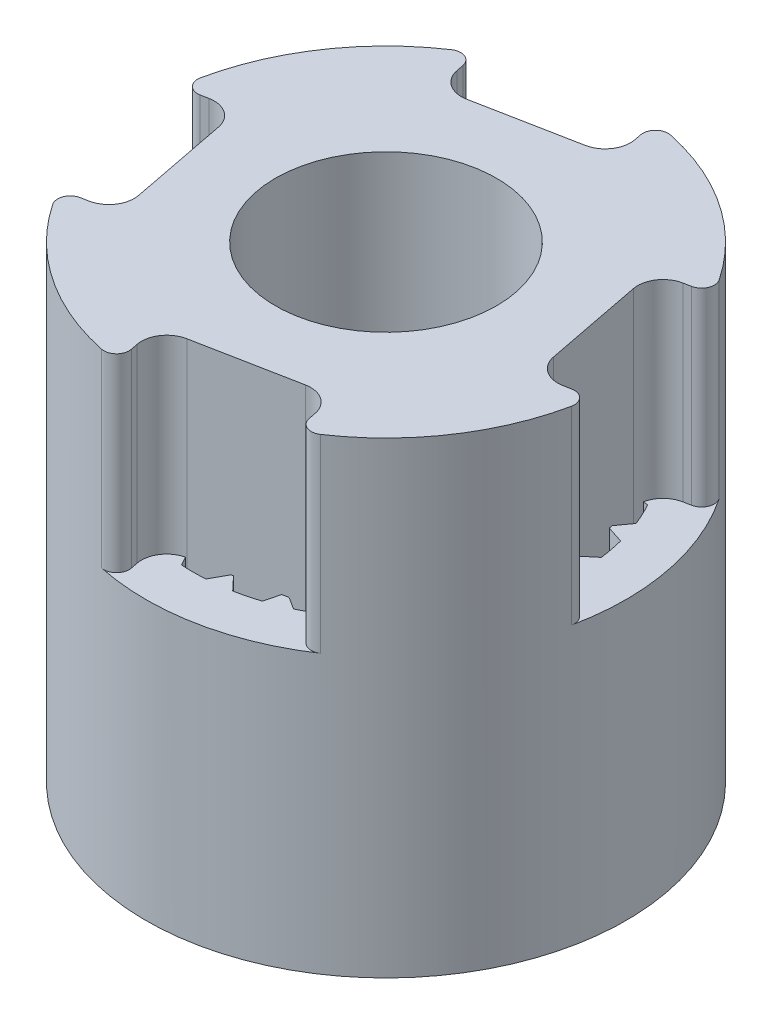
from build123d import *
from build123d.topology import SkipClean

# Parameters (mm, degrees)
BOSS_EXTRUDE1_DEPTH = 3
SKETCH3_R           = 3.8
BOSS_EXTRUDE2_DEPTH = 4.4
SKETCH4_R           = 1.75
CUT_EXTRUDE1_DEPTH  = 105.10898843
SKETCH5_R           = 1.75
BOSS_EXTRUDE3_DEPTH = 0.9


with BuildPart() as part:
    # Sketch1 → Boss-Extrude1 (new body)
    with BuildSketch(Plane(origin=(0, 107.625252291, 0), x_dir=(1, 0, 0), z_dir=(0, 1, 0))):
        with BuildLine():
            Line((-103.3593963, 2.700590533), (-103.244913379, 2.722839185))
            ThreePointArc((-103.244913379, 2.722839185), (-102.944914969, 2.661791791), (-102.775951086, 2.406493856))
            Line((-102.775951086, 2.406493856), (-102.470717158, 0.83587861))
            ThreePointArc((-102.470717158, 0.83587861), (-102.531764552, 0.5358802), (-102.787062488, 0.366916317))
            Line((-102.787062488, 0.366916317), (-102.901545409, 0.344667665))
            ThreePointArc((-102.901545409, 0.344667665), (-103.048087473, 0.225069339), (-103.029426375, 0.03684049))
            ThreePointArc((-103.029426375, 0.03684049), (-101.999811756, -0.994915362), (-100.657527711, -1.563158221))
            ThreePointArc((-100.657527711, -1.563158221), (-100.476010295, -1.509962698), (-100.42000237, -1.329293252))
            Line((-100.42000237, -1.329293252), (-100.442251022, -1.214810331))
            ThreePointArc((-100.442251022, -1.214810331), (-100.381203628, -0.914811922), (-100.125905692, -0.745848038))
            Line((-100.125905692, -0.745848038), (-98.555290447, -0.440614111))
            ThreePointArc((-98.555290447, -0.440614111), (-98.255292037, -0.501661505), (-98.086328154, -0.756959441))
            Line((-98.086328154, -0.756959441), (-98.064079502, -0.871442362))
            ThreePointArc((-98.064079502, -0.871442362), (-97.944481176, -1.017984426), (-97.756252327, -0.999323328))
            ThreePointArc((-97.756252327, -0.999323328), (-96.724496475, 0.030291291), (-96.156253616, 1.372575336))
            ThreePointArc((-96.156253616, 1.372575336), (-96.209449139, 1.554092752), (-96.390118585, 1.610100677))
            Line((-96.390118585, 1.610100677), (-96.504601506, 1.587852025))
            ThreePointArc((-96.504601506, 1.587852025), (-96.804599915, 1.648899419), (-96.973563799, 1.904197355))
            Line((-96.973563799, 1.904197355), (-97.278797726, 3.4748126))
            ThreePointArc((-97.278797726, 3.4748126), (-97.217750332, 3.77481101), (-96.962452396, 3.943774894))
            Line((-96.962452396, 3.943774894), (-96.847969475, 3.966023545))
            ThreePointArc((-96.847969475, 3.966023545), (-96.701427411, 4.085621871), (-96.720088509, 4.27385072))
            ThreePointArc((-96.720088509, 4.27385072), (-97.749703128, 5.305606573), (-99.091987173, 5.873849431))
            ThreePointArc((-99.091987173, 5.873849431), (-99.273504589, 5.820653908), (-99.329512514, 5.639984463))
            Line((-99.329512514, 5.639984463), (-99.307263862, 5.525501542))
            ThreePointArc((-99.307263862, 5.525501542), (-99.368311256, 5.225503132), (-99.623609192, 5.056539249))
            Line((-99.623609192, 5.056539249), (-101.194224437, 4.751305321))
            ThreePointArc((-101.194224437, 4.751305321), (-101.494222847, 4.812352715), (-101.663186731, 5.067650651))
            Line((-101.663186731, 5.067650651), (-101.685435382, 5.182133572))
            ThreePointArc((-101.685435382, 5.182133572), (-101.805033708, 5.328675636), (-101.993262557, 5.310014538))
            ThreePointArc((-101.993262557, 5.310014538), (-103.02501841, 4.280399919), (-103.593261268, 2.938115874))
            ThreePointArc((-103.593261268, 2.938115874), (-103.540065745, 2.756598458), (-103.3593963, 2.700590533))
        make_face()
    extrude(amount=-BOSS_EXTRUDE1_DEPTH)

    # Sketch3 → Boss-Extrude2 (add)
    with BuildSketch(Plane.XZ.offset(-104.625252291)):
        with Locations(Location((-99.874757442, -2.155345605, 0), (0, 0, 180))):
            Circle(SKETCH3_R)
        with BuildLine():
            Line((-99.874757442, -4.938265654), (-99.684432465, -5.199401518))
            ThreePointArc((-99.684432465, -5.199401518), (-99.49249108, -5.181295444), (-99.302077088, -5.151098801))
            Line((-99.302077088, -5.151098801), (-99.182673369, -4.850835103))
            Line((-99.182673369, -4.850835103), (-98.933385953, -5.056435007))
            ThreePointArc((-98.933385953, -5.056435007), (-98.751977556, -4.991163887), (-98.57505537, -4.914561893))
            Line((-98.57505537, -4.914561893), (-98.534075484, -4.594037034))
            Line((-98.534075484, -4.594037034), (-98.241489273, -4.731182379))
            ThreePointArc((-98.241489273, -4.731182379), (-98.082012423, -4.622847438), (-97.929698714, -4.504653278))
            Line((-97.929698714, -4.504653278), (-97.969717577, -4.184007013))
            Line((-97.969717577, -4.184007013), (-97.652216839, -4.244080454))
            ThreePointArc((-97.652216839, -4.244080454), (-97.524692052, -4.099488774), (-97.40655725, -3.947129022))
            Line((-97.40655725, -3.947129022), (-97.525060331, -3.646508735))
            Line((-97.525060331, -3.646508735), (-97.202594805, -3.625735636))
            ThreePointArc((-97.202594805, -3.625735636), (-97.115034932, -3.453972444), (-97.038501882, -3.277020424))
            Line((-97.038501882, -3.277020424), (-97.228043196, -3.015315194))
            Line((-97.228043196, -3.015315194), (-96.920874578, -2.915000805))
            ThreePointArc((-96.920874578, -2.915000805), (-96.878781327, -2.726858615), (-96.848658882, -2.536432872))
            Line((-96.848658882, -2.536432872), (-97.097328851, -2.330086601))
            Line((-97.097328851, -2.330086601), (-96.824757674, -2.156534043))
            ThreePointArc((-96.824757674, -2.156534043), (-96.83077592, -1.963834521), (-96.848956784, -1.771900205))
            Line((-96.848956784, -1.771900205), (-97.141130559, -1.633878388))
            Line((-97.141130559, -1.633878388), (-96.920283472, -1.397992608))
            ThreePointArc((-96.920283472, -1.397992608), (-96.974035067, -1.212843772), (-97.039376869, -1.031460823))
            Line((-97.039376869, -1.031460823), (-97.356696098, -0.970435878))
            Line((-97.356696098, -0.970435878), (-97.201449736, -0.687038447))
            ThreePointArc((-97.201449736, -0.687038447), (-97.299557269, -0.52107388), (-97.407954343, -0.361639255))
            Line((-97.407954343, -0.361639255), (-97.730480691, -0.381445605))
            Line((-97.730480691, -0.381445605), (-97.650589755, -0.068343425))
            ThreePointArc((-97.650589755, -0.068343425), (-97.786888769, 0.068008708), (-97.931530128, 0.195477146))
            Line((-97.931530128, 0.195477146), (-98.238998079, 0.096084008))
            Line((-98.238998079, 0.096084008), (-98.23948241, 0.419217575))
            ThreePointArc((-98.23948241, 0.419217575), (-98.405408736, 0.517389769), (-98.577206033, 0.604882708))
            Line((-98.577206033, 0.604882708), (-98.850296244, 0.432148018))
            Line((-98.850296244, 0.432148018), (-98.931125409, 0.745009302))
            ThreePointArc((-98.931125409, 0.745009302), (-99.116253286, 0.798833036), (-99.304411864, 0.840852973))
            Line((-99.304411864, 0.840852973), (-99.525965074, 0.605630287))
            Line((-99.525965074, 0.605630287), (-99.682060279, 0.888561063))
            ThreePointArc((-99.682060279, 0.888561063), (-99.874757442, 0.894654395), (-100.067454605, 0.888561063))
            Line((-100.067454605, 0.888561063), (-100.223549811, 0.605630287))
            Line((-100.223549811, 0.605630287), (-100.445103021, 0.840852973))
            ThreePointArc((-100.445103021, 0.840852973), (-100.633261598, 0.798833036), (-100.818389475, 0.745009302))
            Line((-100.818389475, 0.745009302), (-100.89921864, 0.432148018))
            Line((-100.89921864, 0.432148018), (-101.172308852, 0.604882708))
            ThreePointArc((-101.172308852, 0.604882708), (-101.344106148, 0.517389769), (-101.510032474, 0.419217575))
            Line((-101.510032474, 0.419217575), (-101.510516805, 0.096084008))
            Line((-101.510516805, 0.096084008), (-101.817984756, 0.195477146))
            ThreePointArc((-101.817984756, 0.195477146), (-101.962626115, 0.068008708), (-102.098925129, -0.068343425))
            Line((-102.098925129, -0.068343425), (-102.019034193, -0.381445605))
            Line((-102.019034193, -0.381445605), (-102.341560541, -0.361639255))
            ThreePointArc((-102.341560541, -0.361639255), (-102.449957615, -0.52107388), (-102.548065148, -0.687038447))
            Line((-102.548065148, -0.687038447), (-102.392818787, -0.970435878))
            Line((-102.392818787, -0.970435878), (-102.710138016, -1.031460823))
            ThreePointArc((-102.710138016, -1.031460823), (-102.775479817, -1.212843772), (-102.829231412, -1.397992608))
            Line((-102.829231412, -1.397992608), (-102.608384325, -1.633878388))
            Line((-102.608384325, -1.633878388), (-102.900558101, -1.771900205))
            ThreePointArc((-102.900558101, -1.771900205), (-102.918738964, -1.963834521), (-102.924757211, -2.156534043))
            Line((-102.924757211, -2.156534043), (-102.652186034, -2.330086601))
            Line((-102.652186034, -2.330086601), (-102.900856002, -2.536432872))
            ThreePointArc((-102.900856002, -2.536432872), (-102.870733557, -2.726858615), (-102.828640307, -2.915000805))
            Line((-102.828640307, -2.915000805), (-102.521471689, -3.015315194))
            Line((-102.521471689, -3.015315194), (-102.711013002, -3.277020424))
            ThreePointArc((-102.711013002, -3.277020424), (-102.634479952, -3.453972444), (-102.546920079, -3.625735636))
            Line((-102.546920079, -3.625735636), (-102.224454553, -3.646508735))
            Line((-102.224454553, -3.646508735), (-102.342957634, -3.947129022))
            ThreePointArc((-102.342957634, -3.947129022), (-102.224822833, -4.099488774), (-102.097298045, -4.244080454))
            Line((-102.097298045, -4.244080454), (-101.779797307, -4.184007013))
            Line((-101.779797307, -4.184007013), (-101.819816171, -4.504653278))
            ThreePointArc((-101.819816171, -4.504653278), (-101.667502462, -4.622847438), (-101.508025611, -4.731182379))
            Line((-101.508025611, -4.731182379), (-101.2154394, -4.594037034))
            Line((-101.2154394, -4.594037034), (-101.174459514, -4.914561893))
            ThreePointArc((-101.174459514, -4.914561893), (-100.997537328, -4.991163887), (-100.816128932, -5.056435007))
            Line((-100.816128932, -5.056435007), (-100.566841515, -4.850835103))
            Line((-100.566841515, -4.850835103), (-100.447437796, -5.151098801))
            ThreePointArc((-100.447437796, -5.151098801), (-100.257023805, -5.181295444), (-100.065082419, -5.199401518))
            Line((-100.065082419, -5.199401518), (-99.874757442, -4.938265654))
        make_face(mode=Mode.SUBTRACT)
    extrude(amount=BOSS_EXTRUDE2_DEPTH)

    # Sketch4 → Cut-Extrude1 (cut, through all)
    with BuildSketch(Plane(origin=(0, 107.625252291, 0), x_dir=(1, 0, 0), z_dir=(0, 1, 0))):
        with Locations(Location((-99.874757442, 2.155345605, 0), (0, 0, 180))):
            Circle(SKETCH4_R)
    extrude(amount=-CUT_EXTRUDE1_DEPTH, mode=Mode.SUBTRACT)

    # Sketch5 → Boss-Extrude3 (add)
    with SkipClean():  # the faces are left unmerged after this step: merging them gives an invalid solid
        with BuildSketch(Plane.XZ.offset(-104.625252291)):
            with BuildLine():
                Line((-97.228043196, -3.015315194), (-97.186886751, -3.001874421))
                Line((-97.186886751, -3.001874421), (-97.062024562, -2.359382089))
                Line((-97.062024562, -2.359382089), (-97.097328851, -2.330086601))
                Line((-97.097328851, -2.330086601), (-97.050541782, -2.30029616))
                Line((-97.050541782, -2.30029616), (-96.973563799, -1.904197355))
                ThreePointArc((-96.973563799, -1.904197355), (-96.947785159, -1.821123878), (-96.904658503, -1.745586917))
                Line((-96.904658503, -1.745586917), (-97.141130559, -1.633878388))
                Line((-97.141130559, -1.633878388), (-96.920283472, -1.397992608))
                ThreePointArc((-96.920283472, -1.397992608), (-96.974035067, -1.212843772), (-97.039376869, -1.031460823))
                Line((-97.039376869, -1.031460823), (-97.356696098, -0.970435878))
                Line((-97.356696098, -0.970435878), (-97.201449736, -0.687038447))
                ThreePointArc((-97.201449736, -0.687038447), (-97.299557269, -0.52107388), (-97.407954343, -0.361639255))
                Line((-97.407954343, -0.361639255), (-97.730480691, -0.381445605))
                Line((-97.730480691, -0.381445605), (-97.650589755, -0.068343425))
                ThreePointArc((-97.650589755, -0.068343425), (-97.786888769, 0.068008708), (-97.931530128, 0.195477146))
                Line((-97.931530128, 0.195477146), (-98.238998079, 0.096084008))
                Line((-98.238998079, 0.096084008), (-98.23948241, 0.419217575))
                ThreePointArc((-98.23948241, 0.419217575), (-98.278392127, 0.443522952), (-98.317663026, 0.467240328))
                ThreePointArc((-98.317663026, 0.467240328), (-98.434440598, 0.435755575), (-98.555290447, 0.440614111))
                Line((-98.555290447, 0.440614111), (-98.770720871, 0.482480937))
                Line((-98.770720871, 0.482480937), (-98.850296244, 0.432148018))
                Line((-98.850296244, 0.432148018), (-98.868193989, 0.501423897))
                Line((-98.868193989, 0.501423897), (-99.507155879, 0.625599979))
                Line((-99.507155879, 0.625599979), (-99.525965074, 0.605630287))
                Line((-99.525965074, 0.605630287), (-99.540564566, 0.632092635))
                Line((-99.540564566, 0.632092635), (-100.125905692, 0.745848038))
                ThreePointArc((-100.125905692, 0.745848038), (-100.134979937, 0.747720849), (-100.144008369, 0.749803338))
                Line((-100.144008369, 0.749803338), (-100.223549811, 0.605630287))
                Line((-100.223549811, 0.605630287), (-100.445103021, 0.840852973))
                ThreePointArc((-100.445103021, 0.840852973), (-100.633261598, 0.798833036), (-100.818389475, 0.745009302))
                Line((-100.818389475, 0.745009302), (-100.89921864, 0.432148018))
                Line((-100.89921864, 0.432148018), (-101.172308852, 0.604882708))
                ThreePointArc((-101.172308852, 0.604882708), (-101.344106148, 0.517389769), (-101.510032474, 0.419217575))
                Line((-101.510032474, 0.419217575), (-101.510516805, 0.096084008))
                Line((-101.510516805, 0.096084008), (-101.817984756, 0.195477146))
                ThreePointArc((-101.817984756, 0.195477146), (-101.962626115, 0.068008708), (-102.098925129, -0.068343425))
                Line((-102.098925129, -0.068343425), (-102.019034193, -0.381445605))
                Line((-102.019034193, -0.381445605), (-102.341560541, -0.361639255))
                ThreePointArc((-102.341560541, -0.361639255), (-102.422200569, -0.478135565), (-102.497343376, -0.598251189))
                ThreePointArc((-102.497343376, -0.598251189), (-102.466191904, -0.71214872), (-102.46965226, -0.830178749))
                Line((-102.46965226, -0.830178749), (-102.392818787, -0.970435878))
                Line((-102.392818787, -0.970435878), (-102.500906788, -0.991222719))
                Line((-102.500906788, -0.991222719), (-102.622806956, -1.618473641))
                Line((-102.622806956, -1.618473641), (-102.608384325, -1.633878388))
                Line((-102.608384325, -1.633878388), (-102.627561272, -1.642937507))
                Line((-102.627561272, -1.642937507), (-102.749108746, -2.268373602))
                Line((-102.749108746, -2.268373602), (-102.652186034, -2.330086601))
                Line((-102.652186034, -2.330086601), (-102.783767335, -2.439272728))
                ThreePointArc((-102.783767335, -2.439272728), (-102.825031937, -2.53502097), (-102.889639086, -2.616852562))
                ThreePointArc((-102.889639086, -2.616852562), (-102.862860609, -2.766687952), (-102.828640307, -2.915000805))
                Line((-102.828640307, -2.915000805), (-102.521471689, -3.015315194))
                Line((-102.521471689, -3.015315194), (-102.711013002, -3.277020424))
                ThreePointArc((-102.711013002, -3.277020424), (-102.634479952, -3.453972444), (-102.546920079, -3.625735636))
                Line((-102.546920079, -3.625735636), (-102.224454553, -3.646508735))
                Line((-102.224454553, -3.646508735), (-102.342957634, -3.947129022))
                ThreePointArc((-102.342957634, -3.947129022), (-102.224822833, -4.099488774), (-102.097298045, -4.244080454))
                Line((-102.097298045, -4.244080454), (-101.779797307, -4.184007013))
                Line((-101.779797307, -4.184007013), (-101.819816171, -4.504653278))
                ThreePointArc((-101.819816171, -4.504653278), (-101.667502462, -4.622847438), (-101.508025611, -4.731182379))
                Line((-101.508025611, -4.731182379), (-101.2154394, -4.594037034))
                Line((-101.2154394, -4.594037034), (-101.195360269, -4.751086287))
                Line((-101.195360269, -4.751086287), (-101.194224437, -4.751305321))
                Line((-101.194224437, -4.751305321), (-100.588818006, -4.868960223))
                Line((-100.588818006, -4.868960223), (-100.566841515, -4.850835103))
                Line((-100.566841515, -4.850835103), (-100.557189517, -4.875106915))
                Line((-100.557189517, -4.875106915), (-99.91910478, -4.999112531))
                Line((-99.91910478, -4.999112531), (-99.874757442, -4.938265654))
                Line((-99.874757442, -4.938265654), (-99.815774138, -5.019193844))
                Line((-99.815774138, -5.019193844), (-99.623609192, -5.056539249))
                ThreePointArc((-99.623609192, -5.056539249), (-99.509735985, -5.097296874), (-99.413250486, -5.170227249))
                ThreePointArc((-99.413250486, -5.170227249), (-99.357575344, -5.16117705), (-99.302077088, -5.151098801))
                Line((-99.302077088, -5.151098801), (-99.182673369, -4.850835103))
                Line((-99.182673369, -4.850835103), (-98.933385953, -5.056435007))
                ThreePointArc((-98.933385953, -5.056435007), (-98.751977556, -4.991163887), (-98.57505537, -4.914561893))
                Line((-98.57505537, -4.914561893), (-98.534075484, -4.594037034))
                Line((-98.534075484, -4.594037034), (-98.241489273, -4.731182379))
                ThreePointArc((-98.241489273, -4.731182379), (-98.082012423, -4.622847438), (-97.929698714, -4.504653278))
                Line((-97.929698714, -4.504653278), (-97.969717577, -4.184007013))
                Line((-97.969717577, -4.184007013), (-97.652216839, -4.244080454))
                ThreePointArc((-97.652216839, -4.244080454), (-97.524692052, -4.099488774), (-97.40655725, -3.947129022))
                Line((-97.40655725, -3.947129022), (-97.525060331, -3.646508735))
                Line((-97.525060331, -3.646508735), (-97.278167468, -3.630603996))
                ThreePointArc((-97.278167468, -3.630603996), (-97.286140641, -3.552739279), (-97.278797726, -3.4748126))
                Line((-97.278797726, -3.4748126), (-97.197653379, -3.057275303))
                Line((-97.197653379, -3.057275303), (-97.228043196, -3.015315194))
            make_face()
            with Locations((-99.874757442, -2.155345605)):
                Circle(SKETCH5_R, mode=Mode.SUBTRACT)
        extrude(amount=BOSS_EXTRUDE3_DEPTH)
    add(part.part.scale(1), mode=Mode.REPLACE)  # the faces are merged on a copy


solid = part.part
